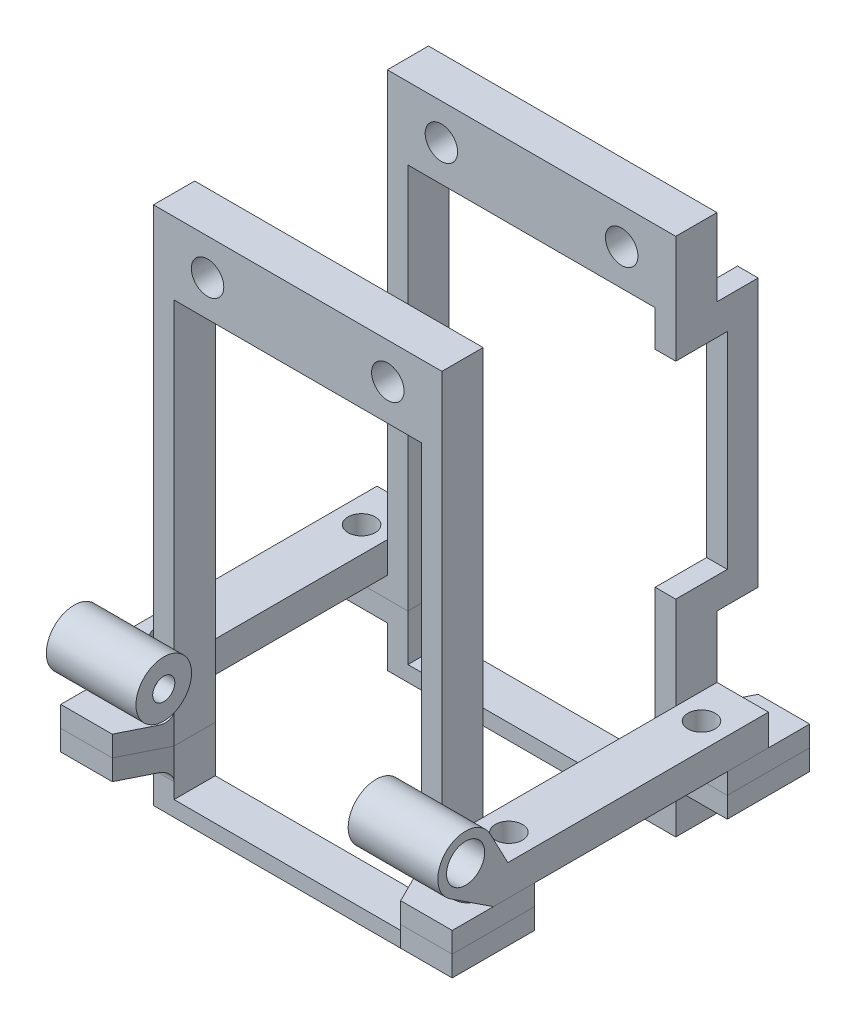
from build123d import *

# Parameters (mm, degrees)
SKETCH1_W            = 28
SKETCH1_H            = 50.5
SKETCH1_R            = 1.575
SKETCH1_W_2          = 24
SKETCH1_H_2          = 42
BOSS_EXTRUDE1_DEPTH  = 4
SKETCH2_W            = 10
SKETCH2_H            = 1.5
BOSS_EXTRUDE2_DEPTH  = 18.7
SKETCH3_W            = 28
SKETCH3_H            = 50.5
SKETCH3_R            = 1.575
SKETCH3_W_2          = 24
SKETCH3_H_2          = 42
BOSS_EXTRUDE3_DEPTH  = 4
SKETCH4_W            = 8
SKETCH4_H            = 4
BOSS_EXTRUDE4_DEPTH  = 5
SKETCH5_W            = 8
SKETCH5_H            = 4
BOSS_EXTRUDE5_DEPTH  = 5
BOSS_EXTRUDE6_DEPTH  = 4
FILLET1_R            = 1
SKETCH7_R            = 1.325
CUT_EXTRUDE1_DEPTH   = 56.765042814
SKETCH8_W            = 10
SKETCH8_H            = 18.7
CUT_EXTRUDE2_DEPTH   = 61.864521685
SPLIT1_START         = -25.25
SPLIT1_OUTLINE_R     = 1.325
SPLIT1_DEPTH         = 6
SPLIT1_START_2       = -21.25
SPLIT1_2_OUTLINE_R   = 1.325
SPLIT1_2_DEPTH       = 2
SPLIT1_3_OUTLINE_W   = 28
SPLIT1_3_OUTLINE_H   = 4
SPLIT1_3_DEPTH       = 1.5
SPLIT1_START_3       = -23.75
SPLIT1_4_OUTLINE_W   = 2
SPLIT1_4_OUTLINE_H   = 4
SPLIT1_4_DEPTH       = 2.5
SPLIT1_START_4       = -14
SPLIT1_5_DEPTH       = 2
SPLIT1_START_5       = 12
SPLIT1_6_DEPTH       = 2
SPLIT1_START_6       = -23
SPLIT1_7_DEPTH       = 1.75
SPLIT1_8_OUTLINE_R   = 1.325
SPLIT1_8_DEPTH       = 2
SPLIT1_9_OUTLINE_W   = 28
SPLIT1_9_OUTLINE_H   = 4
SPLIT1_9_DEPTH       = 1.5
SPLIT1_10_OUTLINE_W  = 2
SPLIT1_10_OUTLINE_H  = 4
SPLIT1_10_DEPTH      = 2.5
SPLIT1_11_DEPTH      = 2
SPLIT1_12_DEPTH      = 2
SPLIT1_13_DEPTH      = 1.75
SPLIT1_14_OUTLINE_R  = 1.325
SPLIT1_14_DEPTH      = 6
SKETCH9_W            = 5
SKETCH9_H            = 26.7
BOSS_EXTRUDE7_DEPTH  = 3
SKETCH11_R           = 1.325
CUT_EXTRUDE4_DEPTH   = 3
SKETCH12_R           = 2.7
BOSS_EXTRUDE8_DEPTH  = 8.7
BOSS_EXTRUDE9_DEPTH  = 5
SKETCH16_R           = 1.073583211
CUT_EXTRUDE6_DEPTH   = 56.785056243
SKETCH17_R           = 1.85
CUT_EXTRUDE7_DEPTH   = 7.2
SKETCH18_W           = 4
SKETCH18_H           = 20
CUT_EXTRUDE8_DEPTH   = 3
BOSS_EXTRUDE10_DEPTH = 2


with BuildPart() as part:
    # Sketch1 → Boss-Extrude1 (new body)
    with BuildSketch(Plane.XY):
        Rectangle(SKETCH1_W, SKETCH1_H)
        with Locations((-8.75, 21.75)):
            Circle(SKETCH1_R, mode=Mode.SUBTRACT)
        with Locations((8.75, 21.75)):
            Circle(SKETCH1_R, mode=Mode.SUBTRACT)
        with Locations((0, -2.75)):
            Rectangle(SKETCH1_W_2, SKETCH1_H_2, mode=Mode.SUBTRACT)
    extrude(amount=BOSS_EXTRUDE1_DEPTH)

    # Sketch2 → Boss-Extrude2 (add)
    with BuildSketch(Plane.XY.offset(4)):
        with Locations((0, -24.5)):
            Rectangle(SKETCH2_W, SKETCH2_H)
    extrude(amount=BOSS_EXTRUDE2_DEPTH)

    # Sketch3 → Boss-Extrude3 (add)
    with BuildSketch(Plane.XY.offset(22.7)):
        Rectangle(SKETCH3_W, SKETCH3_H)
        with Locations((8.75, 21.75)):
            Circle(SKETCH3_R, mode=Mode.SUBTRACT)
        with Locations((-8.75, 21.75)):
            Circle(SKETCH3_R, mode=Mode.SUBTRACT)
        with Locations((0, -2.75)):
            Rectangle(SKETCH3_W_2, SKETCH3_H_2, mode=Mode.SUBTRACT)
    extrude(amount=BOSS_EXTRUDE3_DEPTH)

    # Sketch4 → Boss-Extrude4 (add)
    with BuildSketch(Plane(origin=(14, 0, 0), x_dir=(0, 0, -1), z_dir=(1, 0, 0))):
        with Locations((0, -19.25)):
            Rectangle(SKETCH4_W, SKETCH4_H)
        with Locations((-26.7, -19.25)):
            Rectangle(SKETCH4_W, SKETCH4_H)
    extrude(amount=BOSS_EXTRUDE4_DEPTH)

    # Sketch5 → Boss-Extrude5 (add)
    with BuildSketch(Plane.ZY.offset(14)):
        with Locations((0, -19.25)):
            Rectangle(SKETCH5_W, SKETCH5_H)
        with Locations((26.7, -19.25)):
            Rectangle(SKETCH5_W, SKETCH5_H)
    extrude(amount=BOSS_EXTRUDE5_DEPTH)

    # Sketch6 → Boss-Extrude6 (add)
    with BuildSketch(Plane(origin=(0, -17.25, 0), x_dir=(1, 0, 0), z_dir=(0, 1, 0))):
        Polygon((-14, 4), (-14, 0), (-12, 0), align=None)
        Polygon((12, 0), (14, 4), (14, 0), align=None)
        Polygon((14, -30.7), (14, -26.7), (12, -26.7), align=None)
        Polygon((-12, -26.7), (-14, -30.7), (-14, -26.7), align=None)
    extrude(amount=-BOSS_EXTRUDE6_DEPTH)

    # Fillet1
    fillet1_edges = [part.edges().sort_by_distance(p)[0] for p in [
        (-13, -17.25, 0),
        (-13, -21.25, 0),
        (13, -17.25, 0),
        (13, -21.25, 0),
        (13, -17.25, 26.7),
        (13, -21.25, 26.7),
        (-13, -17.25, 26.7),
        (-13, -21.25, 26.7),
    ]]
    fillet(fillet1_edges, radius=FILLET1_R)

    # Sketch7 → Cut-Extrude1 (cut, through all)
    with BuildSketch(Plane(origin=(0, -17.25, 0), x_dir=(1, 0, 0), z_dir=(0, 1, 0))):
        with Locations(Location((-16.5, 0, 0), (0, 0, 270))):
            Circle(SKETCH7_R)
        with Locations(Location((16.5, 0, 0), (0, 0, 270))):
            Circle(SKETCH7_R)
        with Locations(Location((-16.5, -26.7, 0), (0, 0, 270))):
            Circle(SKETCH7_R)
        with Locations(Location((16.5, -26.7, 0), (0, 0, 270))):
            Circle(SKETCH7_R)
    extrude(amount=-CUT_EXTRUDE1_DEPTH, mode=Mode.SUBTRACT)

    # Sketch8 → Cut-Extrude2 (cut, through all)
    with BuildSketch(Plane(origin=(0, -23.75, 0), x_dir=(1, 0, 0), z_dir=(0, 1, 0))):
        with Locations((0, -13.35)):
            Rectangle(SKETCH8_W, SKETCH8_H)
    extrude(amount=-CUT_EXTRUDE2_DEPTH, mode=Mode.SUBTRACT)


with BuildPart() as cut_extrude2_piece_1:
    # of the separate pieces the step leaves, piece 1, a body of its own (cut_extrude2_pieces)
    add(part.part.solids().sort_by_distance((-14, 25.25, 4))[0])

    # Split1 14 outline → Split1 14 (cut)
    with BuildSketch(Plane(origin=(0, 0, 0), x_dir=(1, 0, 0), z_dir=(0, 1, 0)).offset(SPLIT1_START)):
        Polygon((19, -4), (19, 4), (14, 4), (12, 0), (-12, 0), (-14, 4), (-19, 4), (-19, -4), align=None)
        with Locations((16.5, 0)):
            Circle(SPLIT1_14_OUTLINE_R, mode=Mode.SUBTRACT)
        with Locations((-16.5, 0)):
            Circle(SPLIT1_14_OUTLINE_R, mode=Mode.SUBTRACT)
    extrude(amount=SPLIT1_14_DEPTH, mode=Mode.SUBTRACT)

    # Sketch18 → Cut-Extrude8 (cut)
    with BuildSketch(Plane(origin=(14, 0, 0), x_dir=(0, 0, -1), z_dir=(1, 0, 0))):
        with Locations((-2, 4.75)):
            Rectangle(SKETCH18_W, SKETCH18_H)
    extrude(amount=-CUT_EXTRUDE8_DEPTH, mode=Mode.SUBTRACT)


with BuildPart() as cut_extrude2_piece_2:
    # of the separate pieces the step leaves, piece 2, a body of its own (cut_extrude2_pieces)
    add(part.part.solids().sort_by_distance((14, -22.25, 26.7))[0])

    # Split1: read off the stored shape, not the designer's step
    # Split1 outline → Split1 (cut)
    with BuildSketch(Plane(origin=(0, 0, 0), x_dir=(1, 0, 0), z_dir=(0, 1, 0)).offset(SPLIT1_START)):
        Polygon((14, -30.7), (19, -30.7), (19, -22.7), (-19, -22.7), (-19, -30.7), (-14, -30.7), (-12, -26.7), (12, -26.7), align=None)
        with Locations((16.5, -26.7)):
            Circle(SPLIT1_OUTLINE_R, mode=Mode.SUBTRACT)
        with Locations((-16.5, -26.7)):
            Circle(SPLIT1_OUTLINE_R, mode=Mode.SUBTRACT)
    extrude(amount=SPLIT1_DEPTH, mode=Mode.SUBTRACT)


with BuildPart() as body_3:
    # Split1 2 outline → Split1 2 (new body)
    # profile 1 of 2: a face of its own
    with BuildSketch(Plane(origin=(0, 0, 0), x_dir=(1, 0, 0), z_dir=(0, 1, 0)).offset(SPLIT1_START_2)):
        Polygon((14, -30.7), (19, -30.7), (19, -22.7), (12, -22.7), (12, -26.7), align=None)
        with Locations((16.5, -26.7)):
            Circle(SPLIT1_2_OUTLINE_R, mode=Mode.SUBTRACT)
    # profile 2 of 2: a face of its own
    with BuildSketch(Plane(origin=(0, 0, 0), x_dir=(1, 0, 0), z_dir=(0, 1, 0)).offset(SPLIT1_START_2)):
        Polygon((-14, -30.7), (-12, -26.7), (-12, -22.7), (-19, -22.7), (-19, -30.7), align=None)
        with Locations((-16.5, -26.7)):
            Circle(SPLIT1_2_OUTLINE_R, mode=Mode.SUBTRACT)
    extrude(amount=SPLIT1_2_DEPTH)

    # Split1 3 outline → Split1 3 (add)
    with BuildSketch(Plane(origin=(0, 0, 0), x_dir=(1, 0, 0), z_dir=(0, 1, 0)).offset(SPLIT1_START)):
        with Locations((0, -24.7)):
            Rectangle(SPLIT1_3_OUTLINE_W, SPLIT1_3_OUTLINE_H)
    extrude(amount=SPLIT1_3_DEPTH)

    # Split1 4 outline → Split1 4 (add)
    with BuildSketch(Plane(origin=(0, 0, 0), x_dir=(1, 0, 0), z_dir=(0, 1, 0)).offset(SPLIT1_START_3)):
        with Locations((13, -24.7)):
            Rectangle(SPLIT1_4_OUTLINE_W, SPLIT1_4_OUTLINE_H)
        with Locations((-13, -24.7)):
            Rectangle(SPLIT1_4_OUTLINE_W, SPLIT1_4_OUTLINE_H)
    extrude(amount=SPLIT1_4_DEPTH)

    # Split1 5 outline → Split1 5 (add)
    with BuildSketch(Plane.YZ.offset(SPLIT1_START_4)):
        with BuildLine():
            ThreePointArc((-21.25, 27.7), (-21.542893219, 26.992893219), (-22.25, 26.7))
            Line((-22.25, 26.7), (-21.25, 26.7))
            Line((-21.25, 26.7), (-21.25, 27.7))
        make_face()
    extrude(amount=SPLIT1_5_DEPTH)

    # Split1 6 outline → Split1 6 (add)
    with BuildSketch(Plane.YZ.offset(SPLIT1_START_5)):
        with BuildLine():
            ThreePointArc((-21.25, 27.7), (-21.542893219, 26.992893219), (-22.25, 26.7))
            Line((-22.25, 26.7), (-21.25, 26.7))
            Line((-21.25, 26.7), (-21.25, 27.7))
        make_face()
    extrude(amount=SPLIT1_6_DEPTH)

    # Split1 7 outline → Split1 7 (cut)
    with BuildSketch(Plane(origin=(0, 0, 0), x_dir=(1, 0, 0), z_dir=(0, 1, 0)).offset(SPLIT1_START_6)):
        Polygon((-11.15, -25), (-13.15, -29), (13.15, -29), (11.15, -25), align=None)
    extrude(amount=SPLIT1_7_DEPTH, mode=Mode.SUBTRACT)


with BuildPart() as body_4:
    # Split1 8 outline → Split1 8 (new body)
    # profile 1 of 2: a face of its own
    with BuildSketch(Plane(origin=(0, 0, 0), x_dir=(1, 0, 0), z_dir=(0, 1, 0)).offset(SPLIT1_START_2)):
        Polygon((14, 4), (12, 0), (12, -4), (19, -4), (19, 4), align=None)
        with Locations((16.5, 0)):
            Circle(SPLIT1_8_OUTLINE_R, mode=Mode.SUBTRACT)
    # profile 2 of 2: a face of its own
    with BuildSketch(Plane(origin=(0, 0, 0), x_dir=(1, 0, 0), z_dir=(0, 1, 0)).offset(SPLIT1_START_2)):
        Polygon((-12, -4), (-12, 0), (-14, 4), (-19, 4), (-19, -4), align=None)
        with Locations((-16.5, 0)):
            Circle(SPLIT1_8_OUTLINE_R, mode=Mode.SUBTRACT)
    extrude(amount=SPLIT1_8_DEPTH)

    # Split1 9 outline → Split1 9 (add)
    with BuildSketch(Plane(origin=(0, 0, 0), x_dir=(1, 0, 0), z_dir=(0, 1, 0)).offset(SPLIT1_START)):
        with Locations((0, -2)):
            Rectangle(SPLIT1_9_OUTLINE_W, SPLIT1_9_OUTLINE_H)
    extrude(amount=SPLIT1_9_DEPTH)

    # Split1 10 outline → Split1 10 (add)
    with BuildSketch(Plane(origin=(0, 0, 0), x_dir=(1, 0, 0), z_dir=(0, 1, 0)).offset(SPLIT1_START_3)):
        with Locations((13, -2)):
            Rectangle(SPLIT1_10_OUTLINE_W, SPLIT1_10_OUTLINE_H)
        with Locations((-13, -2)):
            Rectangle(SPLIT1_10_OUTLINE_W, SPLIT1_10_OUTLINE_H)
    extrude(amount=SPLIT1_10_DEPTH)

    # Split1 11 outline → Split1 11 (add)
    with BuildSketch(Plane.YZ.offset(SPLIT1_START_4)):
        with BuildLine():
            Line((-21.25, 0), (-22.25, 0))
            ThreePointArc((-22.25, 0), (-21.542893219, -0.292893219), (-21.25, -1))
            Line((-21.25, -1), (-21.25, 0))
        make_face()
    extrude(amount=SPLIT1_11_DEPTH)

    # Split1 12 outline → Split1 12 (add)
    with BuildSketch(Plane.YZ.offset(SPLIT1_START_5)):
        with BuildLine():
            Line((-21.25, 0), (-22.25, 0))
            ThreePointArc((-22.25, 0), (-21.542893219, -0.292893219), (-21.25, -1))
            Line((-21.25, -1), (-21.25, 0))
        make_face()
    extrude(amount=SPLIT1_12_DEPTH)

    # Split1 13 outline → Split1 13 (cut)
    with BuildSketch(Plane(origin=(0, 0, 0), x_dir=(1, 0, 0), z_dir=(0, 1, 0)).offset(SPLIT1_START_6)):
        Polygon((-13, 2), (-11, -2), (11, -2), (13, 2), align=None)
    extrude(amount=SPLIT1_13_DEPTH, mode=Mode.SUBTRACT)


with BuildPart() as body_5:
    # Sketch9 → Boss-Extrude7 (new body)
    with BuildSketch(Plane(origin=(0, -17.25, 0), x_dir=(1, 0, 0), z_dir=(0, 1, 0))):
        with Locations((-16.5, -13.35)):
            Rectangle(SKETCH9_W, SKETCH9_H)
    extrude(amount=BOSS_EXTRUDE7_DEPTH)

    # Sketch11 → Cut-Extrude4 (cut)
    with BuildSketch(Plane(origin=(0, -14.25, 0), x_dir=(1, 0, 0), z_dir=(0, 1, 0))):
        with Locations(Location((-16.5, -4, 0), (0, 0, 270))):
            Circle(SKETCH11_R)
        with Locations(Location((-16.5, -22.7, 0), (0, 0, 270))):
            Circle(SKETCH11_R)
    extrude(amount=-CUT_EXTRUDE4_DEPTH, mode=Mode.SUBTRACT)


with BuildPart() as body_6:
    # Sketch12 → Boss-Extrude8 (new body)
    with BuildSketch(Plane.ZY.offset(19)):
        with Locations((29.4, -12.25)):
            Circle(SKETCH12_R)
    extrude(amount=-BOSS_EXTRUDE8_DEPTH)


with BuildPart() as body_7:
    # Sketch13 → Boss-Extrude9 (new body)
    with BuildSketch(Plane.ZY.offset(19)):
        with BuildLine():
            Line((25.3, -14.25), (26.7, -17.25))
            Line((26.7, -17.25), (30.880860948, -14.507664912))
            ThreePointArc((30.880860948, -14.507664912), (27.585572751, -14.249463367), (27.00958393, -10.994647057))
            Line((27.00958393, -10.994647057), (25.3, -14.25))
        make_face()
    extrude(amount=-BOSS_EXTRUDE9_DEPTH)


with BuildPart() as body_6_1:
    add(body_6.part)

    # Combine1: union body 7, body 5
    add(body_7.part)
    add(body_5.part)

    # Sketch16 → Cut-Extrude6 (cut, through all)
    with BuildSketch(Plane.ZY.offset(19)):
        with Locations((29.4, -12.25)):
            Circle(SKETCH16_R)
    extrude(amount=-CUT_EXTRUDE6_DEPTH, mode=Mode.SUBTRACT)

    # Sketch17 → Cut-Extrude7 (cut)
    with BuildSketch(Plane.ZY.offset(19)):
        with Locations((29.4, -12.25)):
            Circle(SKETCH17_R)
    extrude(amount=-CUT_EXTRUDE7_DEPTH, mode=Mode.SUBTRACT)


with BuildPart() as body_6_2:
    # Mirror1: mirrored copy
    add(body_6_1.part.mirror(Plane(origin=(0, 0, 0), x_dir=(0, 0, 1), z_dir=(1, 0, 0))))


with BuildPart() as cut_extrude8_piece_1:
    # of the separate pieces the step leaves, piece 1, a body of its own (cut_extrude8_pieces)
    add(cut_extrude2_piece_1.part.solids().sort_by_distance((14, 14.75, 4))[0])



with BuildPart() as cut_extrude8_piece_2:
    # of the separate pieces the step leaves, piece 2, a body of its own (cut_extrude8_pieces)
    add(cut_extrude2_piece_1.part.solids().sort_by_distance((14, -17.25, 4))[0])


with BuildPart() as cut_extrude8_piece_1_1:
    add(cut_extrude8_piece_1.part)

    add(cut_extrude8_piece_2.part)  # Boss-Extrude10 merges Cut-Extrude8 piece 2
    # Sketch19 → Boss-Extrude10 (add)
    with BuildSketch(Plane(origin=(14, 0, 0), x_dir=(0, 0, -1), z_dir=(1, 0, 0))):
        Polygon((0, 14.75), (1, 14.75), (1, -5.25), (0, -5.25), (0, -8.25), (4, -8.25), (4, 17.75), (0, 17.75), align=None)
    extrude(amount=-BOSS_EXTRUDE10_DEPTH)


solid = Compound([cut_extrude2_piece_2.part, body_3.part, body_4.part, body_6_1.part, body_6_2.part, cut_extrude8_piece_1_1.part])
